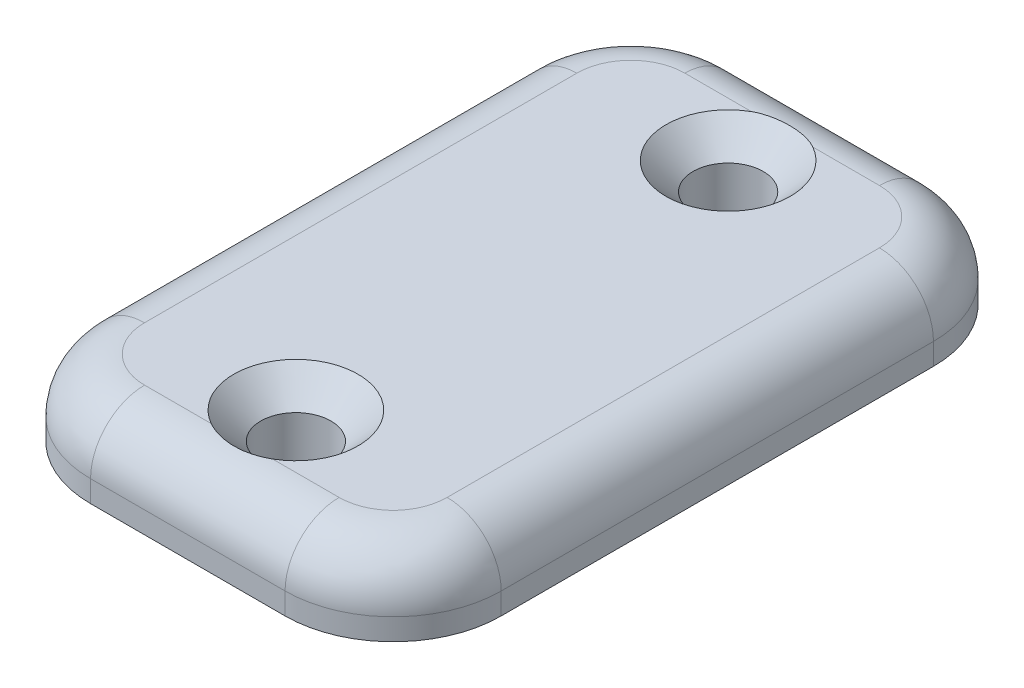
from build123d import *

# Parameters (mm, degrees)
SKETCH1_W           = 43
SKETCH1_H           = 43
SKETCH1_R           = 13.75
SKETCH1_H_2         = 7
BOSS_EXTRUDE1_DEPTH = 60
SKETCH3_R           = 3.25
CUT_EXTRUDE5_DEPTH  = 85.038324591
CHAMFER2_SIZE       = 2.5
CUT_EXTRUDE6_START  = -38
CUT_EXTRUDE6_DEPTH  = 15
SKETCH9_W           = 10
SKETCH9_H           = 51.2
CUT_EXTRUDE7_DEPTH  = 75.012431469
FILLET1_R           = 5
FILLET2_R           = 10


with BuildPart() as part:
    # Sketch1 → Boss-Extrude1 (new body)
    # profile 1 of 3: a face of its own
    with BuildSketch(Plane.XY):
        with Locations((2.5, 2.5)):
            Rectangle(SKETCH1_W, SKETCH1_H)
        Circle(SKETCH1_R, mode=Mode.SUBTRACT)
    # profile 2 of 3: a face of its own
    with BuildSketch(Plane.XY):
        with Locations((2.5, 28.7)):
            Rectangle(SKETCH1_W, SKETCH1_H_2)
    # profile 3 of 3: a face of its own
    with BuildSketch(Plane.XY):
        Polygon((24, 24), (24, -19), (29, -19), (29, 32.2), (24, 32.2), (24, 25.2), align=None)
    extrude(amount=BOSS_EXTRUDE1_DEPTH)

    # Sketch3 → Cut-Extrude5 (cut, through all)
    with BuildSketch(Plane(origin=(0, 32.2, 0), x_dir=(1, 0, 0), z_dir=(0, 1, 0))):
        with Locations(Location((0, -50, 0), (0, 0, 270))):
            Circle(SKETCH3_R)
        with Locations(Location((0, -10, 0), (0, 0, 270))):
            Circle(SKETCH3_R)
    extrude(amount=-CUT_EXTRUDE5_DEPTH, mode=Mode.SUBTRACT)

    # Chamfer2
    chamfer2_edges = [part.edges().sort_by_distance(p)[0] for p in [
        (0, 32.2, 46.75),
        (0, 32.2, 6.75),
    ]]
    chamfer(chamfer2_edges, length=CHAMFER2_SIZE)

    # Sketch7 → Cut-Extrude6 (cut)
    with BuildSketch(Plane.XZ.offset(19).offset(CUT_EXTRUDE6_START)):
        Polygon((0, 43.533676985), (5.6, 46.766838493), (5.6, 53.233161507), (0, 56.466323015), (-5.6, 53.233161507), (-5.6, 46.766838493), align=None)
        Polygon((-5.6, 13.233161507), (0, 16.466323015), (5.6, 13.233161507), (5.6, 6.766838493), (0, 3.533676985), (-5.6, 6.766838493), align=None)
    extrude(amount=CUT_EXTRUDE6_DEPTH, mode=Mode.SUBTRACT)

    # Sketch9 → Cut-Extrude7 (cut, through all)
    with BuildSketch(Plane(origin=(0, 0, 0), x_dir=(-1, 0, 0), z_dir=(0, 0, -1))):
        with Locations((-24, 6.6)):
            Rectangle(SKETCH9_W, SKETCH9_H)
    extrude(amount=-CUT_EXTRUDE7_DEPTH, mode=Mode.SUBTRACT)


with BuildPart() as body_2:
    # of the pieces the cut leaves, the one that is kept (cut_extrude7_keep)
    add(part.part.solids().sort_by_distance((-19, 32.2, 0))[0])

    # Fillet1
    # the kernel refuses this fillet: 5 mm, written as the material it takes off along each edge
    with BuildSketch(Plane(origin=(-31.5, 32.2, 0), x_dir=(0, 0, 1), z_dir=(1, 0, 0)), Plane(origin=(31.5, 32.2, 60), x_dir=(0, 0, -1), z_dir=(-1, 0, 0))) as fillet1_piece_1:
        with BuildLine():
            CenterArc((FILLET1_R, FILLET1_R), FILLET1_R, 180, 90)
            Line((0, FILLET1_R), (0, 0))
            Line((0, 0), (FILLET1_R, 0))
        make_face()
    extrude(amount=63, mode=Mode.SUBTRACT)
    with BuildSketch(Plane(origin=(-19, 32.2, -12.5), x_dir=(1, 0, 0), z_dir=(0, 0, 1))) as fillet1_piece_2:
        with BuildLine():
            CenterArc((FILLET1_R, -FILLET1_R), FILLET1_R, 90, 90)
            Line((0, -FILLET1_R), (0, 0))
            Line((0, 0), (FILLET1_R, 0))
        make_face()
    extrude(amount=85, mode=Mode.SUBTRACT)
    with BuildSketch(Plane(origin=(19, 32.2, -12.5), x_dir=(-1, 0, 0), z_dir=(0, 0, 1))) as fillet1_piece_3:
        with BuildLine():
            CenterArc((FILLET1_R, FILLET1_R), FILLET1_R, 180, 90)
            Line((0, FILLET1_R), (0, 0))
            Line((0, 0), (FILLET1_R, 0))
        make_face()
    extrude(amount=85, mode=Mode.SUBTRACT)

    # Fillet2
    # the kernel refuses this fillet: 10 mm, written as the material it takes off along each edge
    with BuildSketch(Plane(origin=(-9, 32.2, 10), x_dir=(0, 0, -1), z_dir=(1, 0, 0))) as fillet2_piece_1:
        with BuildLine():
            CenterArc((5, -5), 5, 0, 90)
            Line((10, -5), (10, 0))
            Line((10, 0), (5, 0))
        make_face()
    revolve(axis=Axis((-9, 32.2, 10), (0, 1, 0)), revolution_arc=90, mode=Mode.SUBTRACT)
    with BuildSketch(Plane(origin=(9, 32.2, 10), x_dir=(1, 0, 0), z_dir=(0, 0, 1))) as fillet2_piece_2:
        with BuildLine():
            CenterArc((5, -5), 5, 0, 90)
            Line((10, -5), (10, 0))
            Line((10, 0), (5, 0))
        make_face()
    revolve(axis=Axis((9, 32.2, 10), (0, 1, 0)), revolution_arc=90, mode=Mode.SUBTRACT)
    with BuildSketch(Plane(origin=(-9, 32.2, 50), x_dir=(-1, 0, 0), z_dir=(0, 0, -1))) as fillet2_piece_3:
        with BuildLine():
            CenterArc((5, -5), 5, 0, 90)
            Line((10, -5), (10, 0))
            Line((10, 0), (5, 0))
        make_face()
    revolve(axis=Axis((-9, 32.2, 50), (0, 1, 0)), revolution_arc=90, mode=Mode.SUBTRACT)
    with BuildSketch(Plane(origin=(9, 32.2, 50), x_dir=(0, 0, 1), z_dir=(-1, 0, 0))) as fillet2_piece_4:
        with BuildLine():
            CenterArc((5, -5), 5, 0, 90)
            Line((10, -5), (10, 0))
            Line((10, 0), (5, 0))
        make_face()
    revolve(axis=Axis((9, 32.2, 50), (0, 1, 0)), revolution_arc=90, mode=Mode.SUBTRACT)
    with BuildSketch(Plane(origin=(19, 32.2, 0), x_dir=(0, 0, 1), z_dir=(0, -1, 0)), Plane(origin=(-19, 32.2, 60), x_dir=(0, 0, -1), z_dir=(0, -1, 0))) as fillet2_piece_5:
        with BuildLine():
            CenterArc((FILLET2_R, FILLET2_R), FILLET2_R, 180, 90)
            Line((0, FILLET2_R), (0, 0))
            Line((0, 0), (FILLET2_R, 0))
        make_face()
    extrude(amount=32, mode=Mode.SUBTRACT)
    with BuildSketch(Plane(origin=(19, 0.2, 60), x_dir=(-1, 0, 0), z_dir=(0, 1, 0)), Plane(origin=(-19, 32.2, 0), x_dir=(0, 0, 1), z_dir=(0, -1, 0))) as fillet2_piece_6:
        with BuildLine():
            CenterArc((FILLET2_R, -FILLET2_R), FILLET2_R, 90, 90)
            Line((0, -FILLET2_R), (0, 0))
            Line((0, 0), (FILLET2_R, 0))
        make_face()
    extrude(amount=32, mode=Mode.SUBTRACT)


solid = body_2.part
